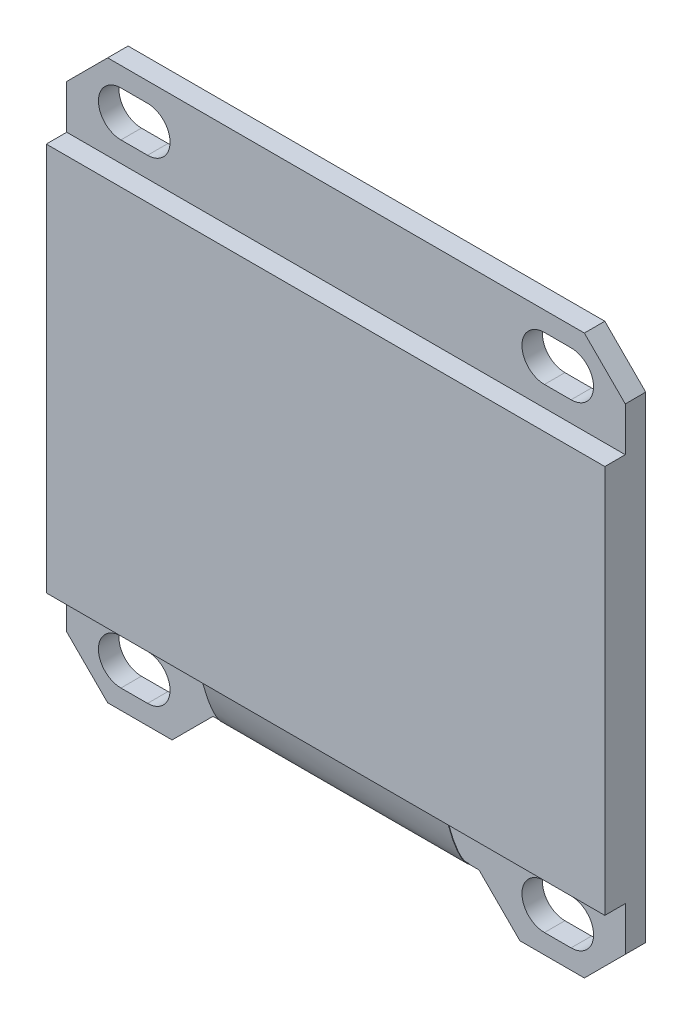
from build123d import *

# Parameters (mm, degrees)
BOSS_EXTRU_1_DEPTH      = 1
ESQUISSE2_W             = 13
ESQUISSE2_H             = 2
ENL_V_MAT_EXTRU_1_DEPTH = 1
CHANFREIN1_SIZE         = 2
ESQUISSE3_W             = 27.3
ESQUISSE3_H             = 19
BOSS_EXTRU_2_DEPTH      = 1
EPAISSIR1_START         = -6
EPAISSIR1_DEPTH         = 12


# Read off the part's stored shape, not the designer's step: Epaissir1
with BuildPart() as part:
    # Esquisse1 → Boss.-Extru.1 (new body)
    with BuildSketch(Plane.XY):
        Polygon((-11.65, -13.65), (11.65, -13.65), (13.65, -11.65), (13.65, 11.65), (11.65, 13.65), (-11.65, 13.65), (-13.65, 11.65), (-13.65, -11.65), align=None)
        with BuildLine():
            Line((-11, 12.7), (-9.7, 12.7))
            ThreePointArc((-9.7, 12.7), (-8.6, 11.6), (-9.7, 10.5))
            Line((-9.7, 10.5), (-11, 10.5))
            ThreePointArc((-11, 10.5), (-12.1, 11.6), (-11, 12.7))
        make_face(mode=Mode.SUBTRACT)
        with BuildLine():
            Line((11, 10.5), (9.7, 10.5))
            ThreePointArc((9.7, 10.5), (8.6, 11.6), (9.7, 12.7))
            Line((9.7, 12.7), (11, 12.7))
            ThreePointArc((11, 12.7), (12.1, 11.6), (11, 10.5))
        make_face(mode=Mode.SUBTRACT)
        with BuildLine():
            Line((-9.7, -12.7), (-11, -12.7))
            ThreePointArc((-11, -12.7), (-12.1, -11.6), (-11, -10.5))
            Line((-11, -10.5), (-9.7, -10.5))
            ThreePointArc((-9.7, -10.5), (-8.6, -11.6), (-9.7, -12.7))
        make_face(mode=Mode.SUBTRACT)
        with BuildLine():
            Line((11, -12.7), (9.7, -12.7))
            ThreePointArc((9.7, -12.7), (8.6, -11.6), (9.7, -10.5))
            Line((9.7, -10.5), (11, -10.5))
            ThreePointArc((11, -10.5), (12.1, -11.6), (11, -12.7))
        make_face(mode=Mode.SUBTRACT)
    extrude(amount=BOSS_EXTRU_1_DEPTH)

    # Esquisse2 → Enlèv. mat.-Extru.1 (cut)
    with BuildSketch(Plane.XY.offset(1)):
        with Locations((0, -12.65)):
            Rectangle(ESQUISSE2_W, ESQUISSE2_H)
    extrude(amount=-ENL_V_MAT_EXTRU_1_DEPTH, mode=Mode.SUBTRACT)

    # Chanfrein1
    chanfrein1_edges = [part.edges().sort_by_distance(p)[0] for p in [
        (6.5, -13.65, 0.5),
        (-6.5, -13.65, 0.5),
    ]]
    chamfer(chanfrein1_edges, length=CHANFREIN1_SIZE - 0.0001)  # a hair under: the kernel refuses the full size

    # Esquisse3 → Boss.-Extru.2 (add)
    with BuildSketch(Plane.XY.offset(1)):
        Rectangle(ESQUISSE3_W, ESQUISSE3_H)
    extrude(amount=BOSS_EXTRU_2_DEPTH)

    # Epaissir1 outline → Epaissir1 (add)
    with BuildSketch(Plane.YZ.offset(EPAISSIR1_START)):
        with BuildLine():
            add(Edge.make_bspline(
                [(-9.499999995, 1.979316014), (-9.705853917, 1.92496296), (-9.931420369, 1.860310756), (-10.169329786, 1.786375477), (-10.412025746, 1.704596537), (-10.652655847, 1.615090027), (-10.882677939, 1.520886463), (-11.096569941, 1.420298319), (-11.284403569, 1.317540699), (-11.441426278, 1.21133535), (-11.557190783, 1.104332165), (-11.626236767, 1.000000099)],
                knots=[0.002227245, 0.002227245, 0.002227245, 0.002227245, 0.002227245, 0.002227245, 0.002227245, 0.002227245, 0.002227245, 0.002227245, 0.002227245, 0.002227245, 0.990890106, 0.990890106, 0.990890106, 0.990890106, 0.990890106, 0.990890106, 0.990890106, 0.990890106, 0.990890106, 0.990890106, 0.990890106, 0.990890106], degree=11))
            Line((-9.499999995, 1.979316014), (-9.5, 2))
            add(Edge.make_bspline(
                [(-9.5, 2), (-10.263312196, 1.798883013), (-11.398783911, 1.403961588), (-11.65, 1)],
                knots=[0, 0, 0, 0, 1, 1, 1, 1], degree=3))
            Line((-11.65, 1), (-11.626236767, 1.000000099))
        make_face()
    extrude(amount=EPAISSIR1_DEPTH)


solid = part.part
